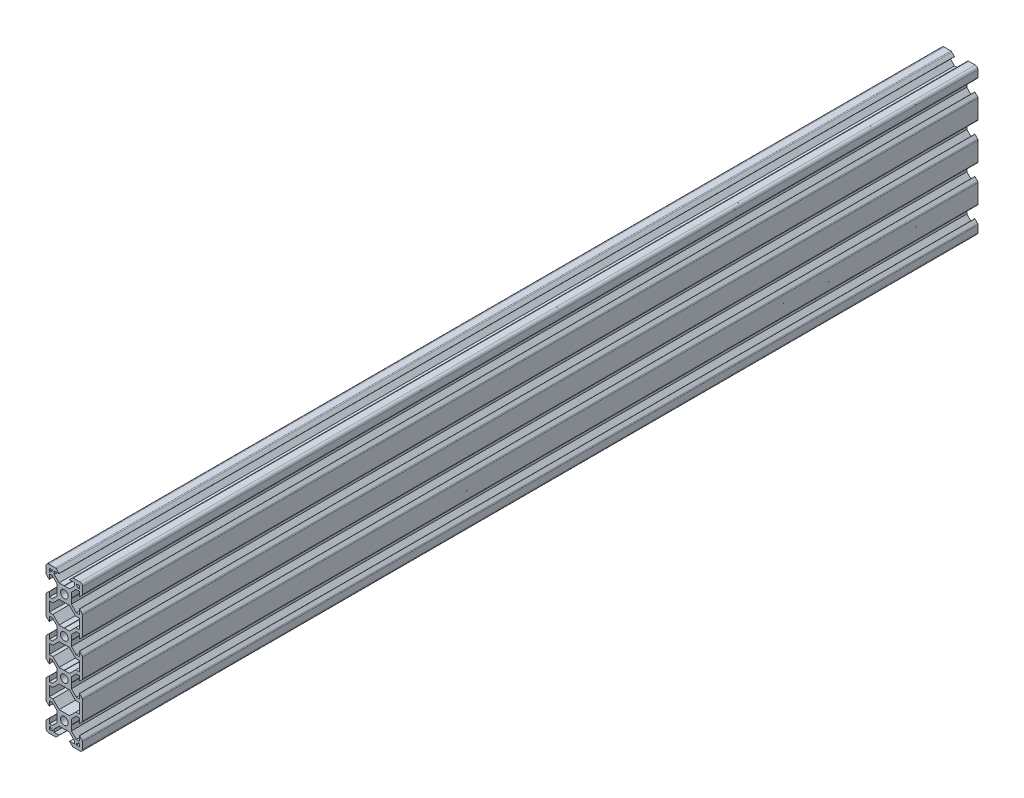
from build123d import *

# Parameters (mm, degrees)
SKETCH3_R           = 2.1
BOSS_EXTRUDE1_DEPTH = 244.75


with BuildPart() as part:
    # Sketch3 → Boss-Extrude1 (new, symmetric)
    with BuildSketch(Plane.XY):
        with BuildLine():
            Line((-0.1, 3.9), (0, 3.8))
            Line((0, 3.8), (0.1, 3.9))
            Line((0.1, 3.9), (2.840365134, 3.9))
            Line((2.840365134, 3.9), (5.5, 6.558825842))
            Line((5.5, 6.558825842), (5.5, 8.197505675))
            Line((5.5, 8.197505675), (2.89, 8.197505675))
            Line((2.89, 8.197505675), (2.89, 8.307505675))
            Line((2.89, 8.307505675), (4.348614357, 9.766120032))
            ThreePointArc((4.348614357, 9.766120032), (4.604908803, 9.937370505), (4.907228714, 9.997505675))
            Line((4.907228714, 9.997505675), (8.5, 9.997505675))
            ThreePointArc((8.5, 9.997505675), (9.560660172, 9.558165846), (10, 8.497505675))
            Line((10, 8.497505675), (10, 4.904734389))
            ThreePointArc((10, 4.904734389), (9.939864831, 4.602414477), (9.768614357, 4.346120032))
            Line((9.768614357, 4.346120032), (8.31, 2.887505675))
            Line((8.31, 2.887505675), (8.2, 2.887505675))
            Line((8.2, 2.887505675), (8.2, 5.497505675))
            Line((8.2, 5.497505675), (6.56, 5.497505675))
            Line((6.56, 5.497505675), (3.9, 2.83831481))
            Line((3.9, 2.83831481), (3.9, 0.1))
            Line((3.9, 0.1), (3.8, 0))
            Line((3.8, 0), (3.9, -0.1))
            Line((3.9, -0.1), (3.9, -2.84))
            Line((3.9, -2.84), (6.56, -5.5))
            Line((6.56, -5.5), (8.21, -5.5))
            Line((8.21, -5.5), (8.21, -2.89))
            Line((8.21, -2.89), (8.31, -2.89))
            Line((8.31, -2.89), (9.765685425, -4.345685425))
            ThreePointArc((9.765685425, -4.345685425), (9.939103626, -4.605224104), (10, -4.91137085))
            Line((10, -4.91137085), (10, -15.08862915))
            ThreePointArc((10, -15.08862915), (9.939103626, -15.394775896), (9.765685425, -15.654314575))
            Line((9.765685425, -15.654314575), (8.31, -17.11))
            Line((8.31, -17.11), (8.21, -17.11))
            Line((8.21, -17.11), (8.21, -14.5))
            Line((8.21, -14.5), (6.56, -14.5))
            Line((6.56, -14.5), (3.9, -17.16))
            Line((3.9, -17.16), (3.9, -19.9))
            Line((3.9, -19.9), (3.8, -20))
            Line((3.8, -20), (3.9, -20.1))
            Line((3.9, -20.1), (3.9, -22.838679656))
            Line((3.9, -22.838679656), (6.56, -25.498679656))
            Line((6.56, -25.498679656), (8.21, -25.498679656))
            Line((8.21, -25.498679656), (8.21, -22.888679656))
            Line((8.21, -22.888679656), (8.31, -22.888679656))
            Line((8.31, -22.888679656), (9.765685425, -24.344365081))
            ThreePointArc((9.765685425, -24.344365081), (9.939103626, -24.60390376), (10, -24.910050506))
            Line((10, -24.910050506), (10, -35.109949494))
            ThreePointArc((10, -35.109949494), (9.939103626, -35.41609624), (9.765685425, -35.675634919))
            Line((9.765685425, -35.675634919), (8.31, -37.131320344))
            Line((8.31, -37.131320344), (8.21, -37.131320344))
            Line((8.21, -37.131320344), (8.21, -34.521320344))
            Line((8.21, -34.521320344), (6.56, -34.521320344))
            Line((6.56, -34.521320344), (3.9, -37.181320344))
            Line((3.9, -37.181320344), (3.9, -39.92))
            Line((3.9, -39.92), (3.8, -40.02))
            Line((3.8, -40.02), (3.9, -40.12))
            Line((3.9, -40.12), (3.9, -42.86))
            Line((3.9, -42.86), (6.56, -45.52))
            Line((6.56, -45.52), (8.21, -45.52))
            Line((8.21, -45.52), (8.21, -42.91))
            Line((8.21, -42.91), (8.31, -42.91))
            Line((8.31, -42.91), (9.765685425, -44.365685425))
            ThreePointArc((9.765685425, -44.365685425), (9.939103626, -44.625224104), (10, -44.93137085))
            Line((10, -44.93137085), (10, -55.10862915))
            ThreePointArc((10, -55.10862915), (9.939103626, -55.414775896), (9.765685425, -55.674314575))
            Line((9.765685425, -55.674314575), (8.31, -57.13))
            Line((8.31, -57.13), (8.21, -57.13))
            Line((8.21, -57.13), (8.21, -54.52))
            Line((8.21, -54.52), (6.56, -54.52))
            Line((6.56, -54.52), (3.9, -57.18))
            Line((3.9, -57.18), (3.9, -59.92))
            Line((3.9, -59.92), (3.8, -60.02))
            Line((3.8, -60.02), (3.9, -60.12))
            Line((3.9, -60.12), (3.9, -62.85831481))
            Line((3.9, -62.85831481), (6.56, -65.517505675))
            Line((6.56, -65.517505675), (8.2, -65.517505675))
            Line((8.2, -65.517505675), (8.2, -62.907505675))
            Line((8.2, -62.907505675), (8.31, -62.907505675))
            Line((8.31, -62.907505675), (9.768614357, -64.366120032))
            ThreePointArc((9.768614357, -64.366120032), (9.939864831, -64.622414477), (10, -64.924734389))
            Line((10, -64.924734389), (10, -68.517505675))
            ThreePointArc((10, -68.517505675), (9.560660172, -69.578165846), (8.5, -70.017505675))
            Line((8.5, -70.017505675), (4.907228714, -70.017505675))
            ThreePointArc((4.907228714, -70.017505675), (4.604908803, -69.957370505), (4.348614357, -69.786120032))
            Line((4.348614357, -69.786120032), (2.89, -68.327505675))
            Line((2.89, -68.327505675), (2.89, -68.217505675))
            Line((2.89, -68.217505675), (5.5, -68.217505675))
            Line((5.5, -68.217505675), (5.5, -66.578825842))
            Line((5.5, -66.578825842), (2.840365134, -63.92))
            Line((2.840365134, -63.92), (0.1, -63.92))
            Line((0.1, -63.92), (0, -63.82))
            Line((0, -63.82), (-0.1, -63.92))
            Line((-0.1, -63.92), (-2.840365134, -63.92))
            Line((-2.840365134, -63.92), (-5.5, -66.578825842))
            Line((-5.5, -66.578825842), (-5.5, -68.217505675))
            Line((-5.5, -68.217505675), (-2.89, -68.217505675))
            Line((-2.89, -68.217505675), (-2.89, -68.327505675))
            Line((-2.89, -68.327505675), (-4.348614357, -69.786120032))
            ThreePointArc((-4.348614357, -69.786120032), (-4.604908803, -69.957370505), (-4.907228714, -70.017505675))
            Line((-4.907228714, -70.017505675), (-8.5, -70.017505675))
            ThreePointArc((-8.5, -70.017505675), (-9.560660172, -69.578165846), (-10, -68.517505675))
            Line((-10, -68.517505675), (-10, -64.924734389))
            ThreePointArc((-10, -64.924734389), (-9.939864831, -64.622414477), (-9.768614357, -64.366120032))
            Line((-9.768614357, -64.366120032), (-8.31, -62.907505675))
            Line((-8.31, -62.907505675), (-8.2, -62.907505675))
            Line((-8.2, -62.907505675), (-8.2, -65.517505675))
            Line((-8.2, -65.517505675), (-6.56, -65.517505675))
            Line((-6.56, -65.517505675), (-3.9, -62.85831481))
            Line((-3.9, -62.85831481), (-3.9, -60.12))
            Line((-3.9, -60.12), (-3.8, -60.02))
            Line((-3.8, -60.02), (-3.9, -59.92))
            Line((-3.9, -59.92), (-3.9, -57.18))
            Line((-3.9, -57.18), (-6.56, -54.52))
            Line((-6.56, -54.52), (-8.21, -54.52))
            Line((-8.21, -54.52), (-8.21, -57.13))
            Line((-8.21, -57.13), (-8.31, -57.13))
            Line((-8.31, -57.13), (-9.765685425, -55.674314575))
            ThreePointArc((-9.765685425, -55.674314575), (-9.939103626, -55.414775896), (-10, -55.10862915))
            Line((-10, -55.10862915), (-10, -44.93137085))
            ThreePointArc((-10, -44.93137085), (-9.939103626, -44.625224104), (-9.765685425, -44.365685425))
            Line((-9.765685425, -44.365685425), (-8.31, -42.91))
            Line((-8.31, -42.91), (-8.21, -42.91))
            Line((-8.21, -42.91), (-8.21, -45.52))
            Line((-8.21, -45.52), (-6.56, -45.52))
            Line((-6.56, -45.52), (-3.9, -42.86))
            Line((-3.9, -42.86), (-3.9, -40.12))
            Line((-3.9, -40.12), (-3.8, -40.02))
            Line((-3.8, -40.02), (-3.9, -39.92))
            Line((-3.9, -39.92), (-3.9, -37.181320344))
            Line((-3.9, -37.181320344), (-6.56, -34.521320344))
            Line((-6.56, -34.521320344), (-8.21, -34.521320344))
            Line((-8.21, -34.521320344), (-8.21, -37.131320344))
            Line((-8.21, -37.131320344), (-8.31, -37.131320344))
            Line((-8.31, -37.131320344), (-9.765685425, -35.675634919))
            ThreePointArc((-9.765685425, -35.675634919), (-9.939103626, -35.41609624), (-10, -35.109949494))
            Line((-10, -35.109949494), (-10, -24.910050506))
            ThreePointArc((-10, -24.910050506), (-9.939103626, -24.60390376), (-9.765685425, -24.344365081))
            Line((-9.765685425, -24.344365081), (-8.31, -22.888679656))
            Line((-8.31, -22.888679656), (-8.21, -22.888679656))
            Line((-8.21, -22.888679656), (-8.21, -25.498679656))
            Line((-8.21, -25.498679656), (-6.56, -25.498679656))
            Line((-6.56, -25.498679656), (-3.9, -22.838679656))
            Line((-3.9, -22.838679656), (-3.9, -20.1))
            Line((-3.9, -20.1), (-3.8, -20))
            Line((-3.8, -20), (-3.9, -19.9))
            Line((-3.9, -19.9), (-3.9, -17.16))
            Line((-3.9, -17.16), (-6.56, -14.5))
            Line((-6.56, -14.5), (-8.21, -14.5))
            Line((-8.21, -14.5), (-8.21, -17.11))
            Line((-8.21, -17.11), (-8.31, -17.11))
            Line((-8.31, -17.11), (-9.765685425, -15.654314575))
            ThreePointArc((-9.765685425, -15.654314575), (-9.939103626, -15.394775896), (-10, -15.08862915))
            Line((-10, -15.08862915), (-10, -4.91137085))
            ThreePointArc((-10, -4.91137085), (-9.939103626, -4.605224104), (-9.765685425, -4.345685425))
            Line((-9.765685425, -4.345685425), (-8.31, -2.89))
            Line((-8.31, -2.89), (-8.21, -2.89))
            Line((-8.21, -2.89), (-8.21, -5.5))
            Line((-8.21, -5.5), (-6.56, -5.5))
            Line((-6.56, -5.5), (-3.9, -2.84))
            Line((-3.9, -2.84), (-3.9, -0.1))
            Line((-3.9, -0.1), (-3.8, 0))
            Line((-3.8, 0), (-3.9, 0.1))
            Line((-3.9, 0.1), (-3.9, 2.83831481))
            Line((-3.9, 2.83831481), (-6.56, 5.497505675))
            Line((-6.56, 5.497505675), (-8.2, 5.497505675))
            Line((-8.2, 5.497505675), (-8.2, 2.887505675))
            Line((-8.2, 2.887505675), (-8.31, 2.887505675))
            Line((-8.31, 2.887505675), (-9.768614357, 4.346120032))
            ThreePointArc((-9.768614357, 4.346120032), (-9.939864831, 4.602414477), (-10, 4.904734389))
            Line((-10, 4.904734389), (-10, 8.497505675))
            ThreePointArc((-10, 8.497505675), (-9.560660172, 9.558165846), (-8.5, 9.997505675))
            Line((-8.5, 9.997505675), (-4.907228714, 9.997505675))
            ThreePointArc((-4.907228714, 9.997505675), (-4.604908803, 9.937370505), (-4.348614357, 9.766120032))
            Line((-4.348614357, 9.766120032), (-2.89, 8.307505675))
            Line((-2.89, 8.307505675), (-2.89, 8.197505675))
            Line((-2.89, 8.197505675), (-5.5, 8.197505675))
            Line((-5.5, 8.197505675), (-5.5, 6.558825842))
            Line((-5.5, 6.558825842), (-2.840365134, 3.9))
            Line((-2.840365134, 3.9), (-0.1, 3.9))
        make_face()
        Circle(SKETCH3_R, mode=Mode.SUBTRACT)
        with Locations((0, -20)):
            Circle(SKETCH3_R, mode=Mode.SUBTRACT)
        with Locations((0, -40.02)):
            Circle(SKETCH3_R, mode=Mode.SUBTRACT)
        with Locations((0, -60.02)):
            Circle(SKETCH3_R, mode=Mode.SUBTRACT)
        Polygon((-7.66, 6.567505675), (-6.57, 7.657505675), (-6.57, 8.197505675), (-8.2, 8.197505675), (-8.2, 6.567505675), align=None, mode=Mode.SUBTRACT)
        Polygon((2.840365134, -3.9), (-2.840365134, -3.9), (-6.25, -7.309634866), (-8.21, -7.309634866), (-8.21, -12.7), (-6.25, -12.7), (-2.85, -16.1), (-0.1, -16.1), (0, -16.2), (0.1, -16.1), (2.85, -16.1), (6.25, -12.7), (8.21, -12.7), (8.21, -7.309634866), (6.25, -7.309634866), align=None, mode=Mode.SUBTRACT)
        Polygon((-0.1, -23.9), (0, -23.8), (0.1, -23.9), (2.84, -23.9), (6.25, -27.31), (8.21, -27.31), (8.21, -32.71), (6.25, -32.71), (2.84, -36.12), (0.1, -36.12), (0, -36.22), (-0.1, -36.12), (-2.84, -36.12), (-6.25, -32.71), (-8.21, -32.71), (-8.21, -27.31), (-6.25, -27.31), (-2.84, -23.9), align=None, mode=Mode.SUBTRACT)
        Polygon((8.2, 6.567505675), (7.66, 6.567505675), (6.57, 7.657505675), (6.57, 8.197505675), (8.2, 8.197505675), align=None, mode=Mode.SUBTRACT)
        Polygon((7.66, -66.587505675), (6.57, -67.677505675), (6.57, -68.217505675), (8.2, -68.217505675), (8.2, -66.587505675), align=None, mode=Mode.SUBTRACT)
        Polygon((2.840365134, -56.12), (6.25, -52.710365134), (8.21, -52.710365134), (8.21, -47.32), (6.25, -47.32), (2.85, -43.92), (0.1, -43.92), (0, -43.82), (-0.1, -43.92), (-2.85, -43.92), (-6.25, -47.32), (-8.21, -47.32), (-8.21, -52.710365134), (-6.25, -52.710365134), (-2.840365134, -56.12), align=None, mode=Mode.SUBTRACT)
        Polygon((-8.2, -66.587505675), (-7.66, -66.587505675), (-6.57, -67.677505675), (-6.57, -68.217505675), (-8.2, -68.217505675), align=None, mode=Mode.SUBTRACT)
    extrude(amount=BOSS_EXTRUDE1_DEPTH, both=True)


solid = part.part
